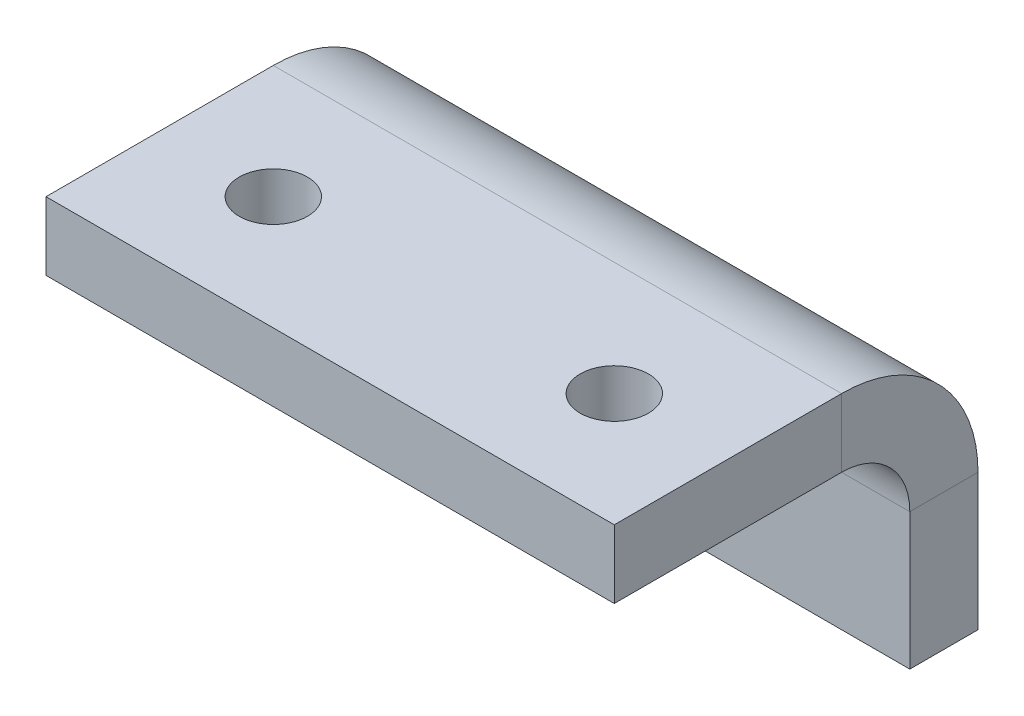
from build123d import *

# Parameters (mm, degrees)
SKETCH1_W                = 25
SKETCH1_H                = 10
BASE_FLANGE1_DEPTH       = 3
F_3_0_3_DIAMETER_HOLE1_D = 3
SM_EDGE_FLANGE_1_DEPTH   = 25


# Sheet-metal steps are written as plain solids
with BuildPart() as part:
    # Sketch1 → Base-Flange1 (new body)
    with BuildSketch(Plane(origin=(0, 0, 0), x_dir=(1, 0, 0), z_dir=(0, 1, 0))):
        with Locations((-12.5, 5)):
            Rectangle(SKETCH1_W, SKETCH1_H)
    extrude(amount=-BASE_FLANGE1_DEPTH)

    # Ø3.0 (3) Diameter Hole1 (through all)
    with Locations(Plane(origin=(0, 0, 0), x_dir=(1, 0, 0), z_dir=(0, 1, 0))):
        with Locations((-20, 5), (-5, 5)):
            Hole(F_3_0_3_DIAMETER_HOLE1_D / 2)

    # 邊線-凸緣1 section (across the edge) → 邊線-凸緣1 (add)
    with BuildSketch(Plane(origin=(-25, -3, -13), x_dir=(0, 0, 1), z_dir=(1, 0, 0))):
        with BuildLine():
            Line((-3, 3), (-3, 9))
            Line((-3, 9), (0, 9))
            Line((0, 9), (0, 3))
            ThreePointArc((0, 3), (0.878679656, 0.878679656), (3, 0))
            Line((3, 0), (3, -3))
            ThreePointArc((3, -3), (-1.242640687, -1.242640687), (-3, 3))
        make_face()
    extrude(amount=SM_EDGE_FLANGE_1_DEPTH)


solid = part.part
